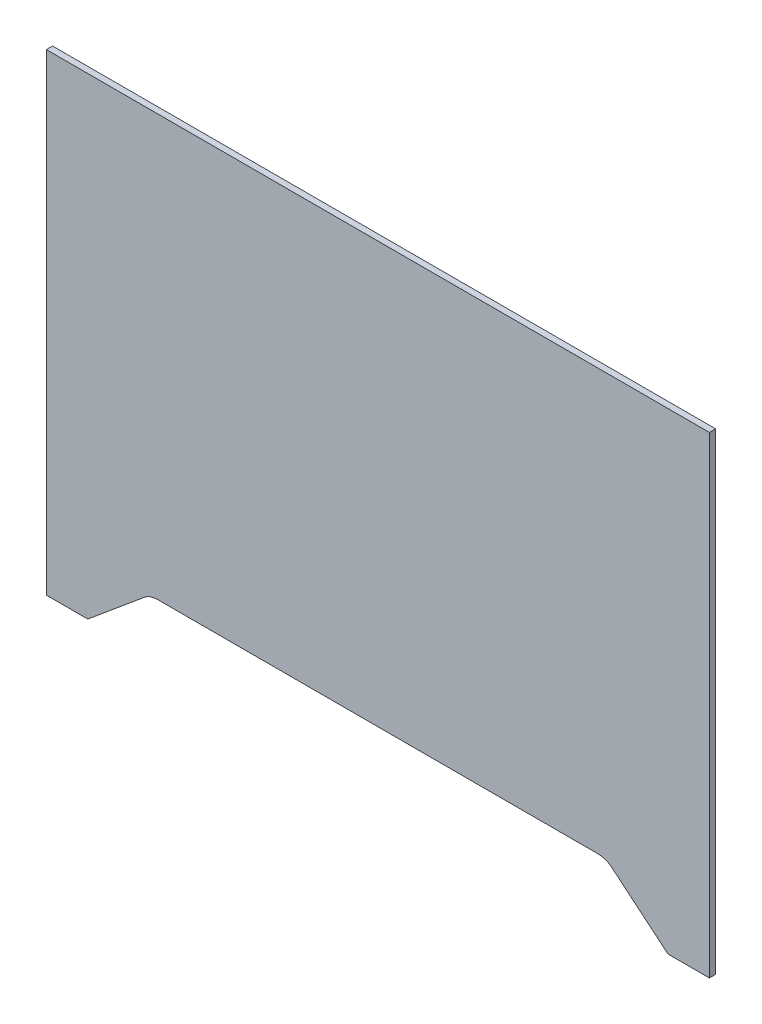
from build123d import *

# Parameters (mm, degrees)
BOSS_EXTRUDE1_DEPTH = 3


with BuildPart() as part:
    # Sketch1 → Boss-Extrude1 (new body)
    with BuildSketch(Plane.XY):
        with BuildLine():
            Line((-160, -114), (-160, 114))
            Line((-160, 114), (160, 114))
            Line((160, 114), (160, -114))
            Line((160, -114), (140, -114))
            Line((140, -114), (112.781344645, -91.317787204))
            ThreePointArc((112.781344645, -91.317787204), (109.783753286, -89.597284223), (106.379500648, -89))
            Line((106.379500648, -89), (-106.379500648, -89))
            ThreePointArc((-106.379500648, -89), (-109.783753286, -89.597284223), (-112.781344645, -91.317787204))
            Line((-112.781344645, -91.317787204), (-140, -114))
            Line((-140, -114), (-160, -114))
        make_face()
    extrude(amount=BOSS_EXTRUDE1_DEPTH)


solid = part.part
